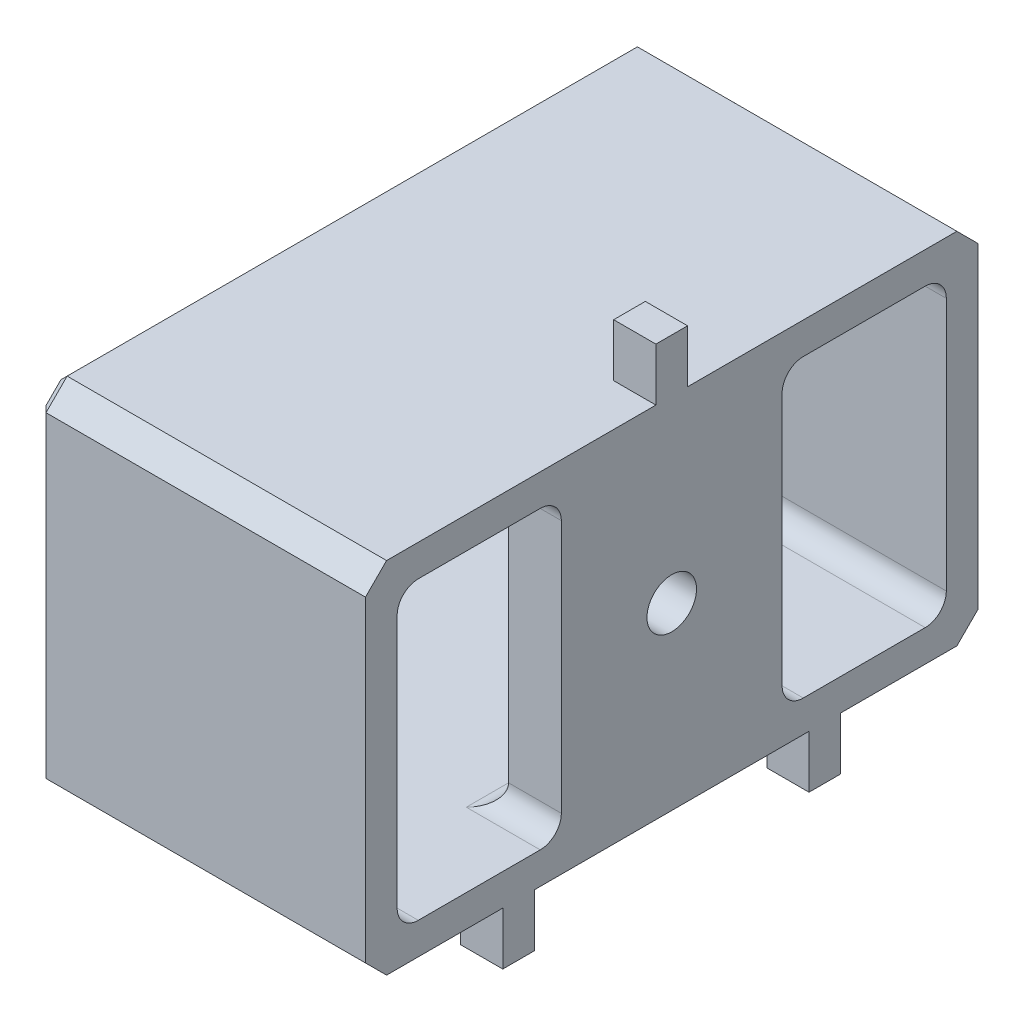
from build123d import *

# Parameters (mm, degrees)
SKETCH2_W             = 14.732
SKETCH2_H             = 8.636
SKETCH2_W_2           = 13.208
SKETCH2_H_2           = 7.112
EXTRUDE_THIN1_DEPTH   = 7.9375
SKETCH3_W             = 14.732
SKETCH3_H             = 8.636
BOSS_EXTRUDE1_DEPTH   = 1.27
CUT_EXTRUDE1_REACH    = 71.359
SKETCH4_W             = 3.949
SKETCH4_H             = 7.112
SKETCH7_R             = 1.016
BOSS_EXTRUDE2_DEPTH   = 1.27
F_0_80_TAPPED_HOLE1_D = 1.19126
SKETCH9_W             = 0.762
SKETCH9_H             = 1.27
EXTRUDE_THIN2_DEPTH   = 1.27
FILLET1_R             = 0.508
CHAMFER1_SIZE         = 0.508
CHAMFER2_SIZE         = 0.254


with BuildPart() as part:
    # Sketch2 → Extrude-Thin1 (new body)
    with BuildSketch(Plane(origin=(-2.794, 0, 0), x_dir=(0, 0, -1), z_dir=(1, 0, 0))):
        with Locations((-7.366, -62.992)):
            Rectangle(SKETCH2_W, SKETCH2_H)
        with Locations((-7.366, -62.992)):
            Rectangle(SKETCH2_W_2, SKETCH2_H_2, mode=Mode.SUBTRACT)
    extrude(amount=EXTRUDE_THIN1_DEPTH)

    # Sketch3 → Boss-Extrude1 (add)
    with BuildSketch(Plane(origin=(5.1435, 0, 0), x_dir=(0, 0, -1), z_dir=(1, 0, 0))):
        with Locations((-7.366, -62.992)):
            Rectangle(SKETCH3_W, SKETCH3_H)
    extrude(amount=-BOSS_EXTRUDE1_DEPTH)

    # Sketch4 → Cut-Extrude1 (cut, up to next)
    with BuildSketch(Plane(origin=(5.1435, 0, 0), x_dir=(0, 0, -1), z_dir=(1, 0, 0)), mode=Mode.PRIVATE) as cut_extrude1_sk1:
        with Locations((-2.7365, -62.992)):
            Rectangle(SKETCH4_W, SKETCH4_H)
    cut_extrude1_tool1 = extrude(cut_extrude1_sk1.sketch, amount=-CUT_EXTRUDE1_REACH, mode=Mode.PRIVATE) & part.part
    # Sketch4 → Cut-Extrude1 (cut, up to next)
    with BuildSketch(Plane(origin=(5.1435, 0, 0), x_dir=(0, 0, -1), z_dir=(1, 0, 0)), mode=Mode.PRIVATE) as cut_extrude1_sk2:
        with Locations((-11.9955, -62.992)):
            Rectangle(SKETCH4_W, SKETCH4_H)
    cut_extrude1_tool2 = extrude(cut_extrude1_sk2.sketch, amount=-CUT_EXTRUDE1_REACH, mode=Mode.PRIVATE) & part.part
    add(cut_extrude1_tool1.solids().sort_by_distance((5.1435, -62.992, 2.7365))[0], mode=Mode.SUBTRACT)
    add(cut_extrude1_tool2.solids().sort_by_distance((5.1435, -62.992, 11.9955))[0], mode=Mode.SUBTRACT)

    # Sketch7 → Boss-Extrude2 (add)
    with BuildSketch(Plane.ZY.offset(-3.8735)):
        with Locations((7.366, -62.992)):
            Circle(SKETCH7_R)
    extrude(amount=BOSS_EXTRUDE2_DEPTH)

    # #0-80 Tapped Hole1 (through all)
    with Locations(Plane(origin=(5.1435, 0, 0), x_dir=(0, 0, -1), z_dir=(1, 0, 0))):
        with Locations((-7.366, -62.992)):
            Hole(F_0_80_TAPPED_HOLE1_D / 2)

    # Sketch9 → Extrude-Thin2 (add)
    with BuildSketch(Plane(origin=(5.1435, 0, 0), x_dir=(0, 0, -1), z_dir=(1, 0, 0))):
        with Locations((-7.366, -58.039)):
            Rectangle(SKETCH9_W, SKETCH9_H)
        with Locations((-11.049, -67.945)):
            Rectangle(SKETCH9_W, SKETCH9_H)
        with Locations((-3.683, -67.945)):
            Rectangle(SKETCH9_W, SKETCH9_H)
    extrude(amount=-EXTRUDE_THIN2_DEPTH)

    # Fillet1
    fillet1_edges = [part.edges().sort_by_distance(p)[0] for p in [
        (3.8735, -66.548, 7.366),
        (1.17475, -59.436, 13.97),
        (1.17475, -59.436, 0.762),
        (1.17475, -66.548, 0.762),
        (3.8735, -59.436, 7.366),
        (1.17475, -66.548, 13.97),
        (4.5085, -59.436, 10.021),
        (4.5085, -59.436, 4.711),
        (4.5085, -66.548, 4.711),
        (4.5085, -66.548, 10.021),
        (3.8735, -62.992, 6.35),
    ]]
    fillet(fillet1_edges, radius=FILLET1_R)

    # Chamfer1
    chamfer1_edges = [part.edges().sort_by_distance(p)[0] for p in [
        (1.17475, -67.31, 14.732),
        (1.17475, -67.31, 0),
        (1.17475, -58.674, 0),
        (1.17475, -58.674, 14.732),
    ]]
    chamfer(chamfer1_edges, length=CHAMFER1_SIZE)

    # Chamfer2
    chamfer2_edges = [part.edges().sort_by_distance(p)[0] for p in [
        (-2.794, -67.056, 14.478),
        (-2.794, -67.31, 7.366),
        (-2.794, -67.056, 0.254),
        (-2.794, -62.992, 0),
        (-2.794, -58.928, 0.254),
        (-2.794, -62.992, 14.732),
        (-2.794, -58.928, 14.478),
        (-2.794, -58.674, 7.366),
        (3.8735, -58.039, 6.985),
        (3.8735, -57.404, 7.366),
        (3.8735, -58.039, 7.747),
        (3.8735, -67.945, 10.668),
        (3.8735, -68.58, 11.049),
        (3.8735, -67.945, 11.43),
        (3.8735, -67.945, 3.302),
        (3.8735, -68.58, 3.683),
        (3.8735, -67.945, 4.064),
    ]]
    chamfer(chamfer2_edges, length=CHAMFER2_SIZE)


solid = part.part
